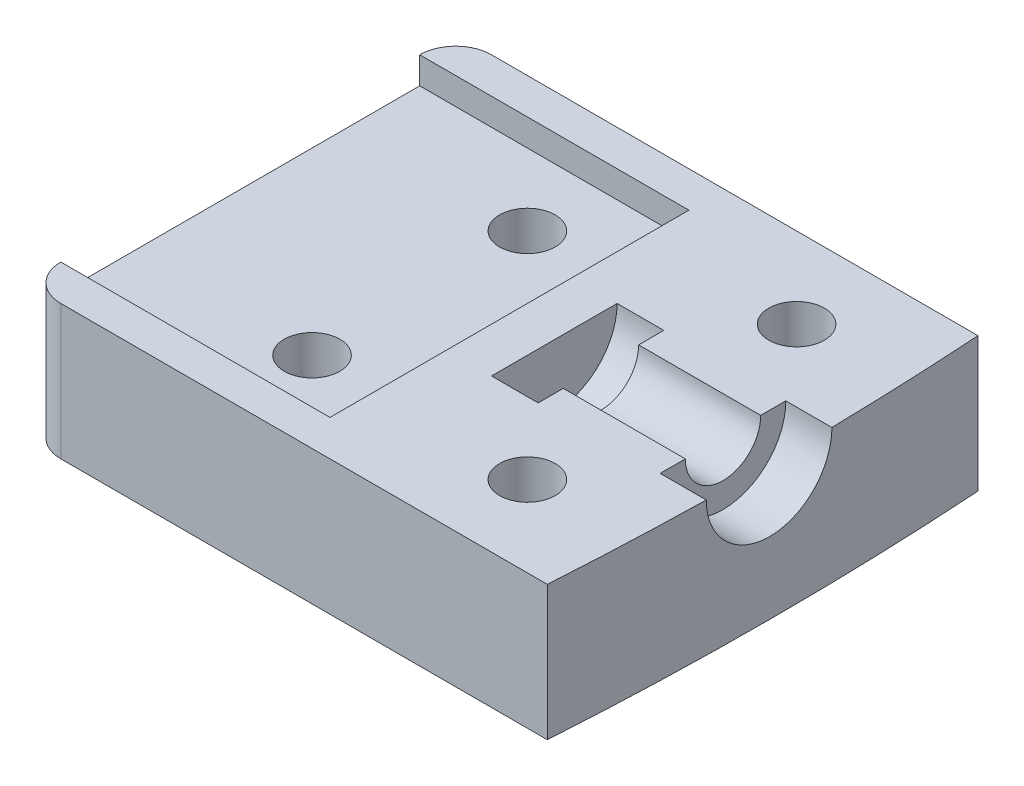
from build123d import *

# Parameters (mm, degrees)
BOSS_EXTRUDE1_DEPTH        = 10
SKETCH2_W                  = 15
SKETCH2_H                  = 20
CUT_EXTRUDE1_DEPTH         = 1.5
SKETCH4_R                  = 2.1
CUT_EXTRUDE2_DEPTH         = 24.457408211
FILLET1_R                  = 2
SKETCH5_R                  = 3.5
CUT_EXTRUDE3_DEPTH         = 2.6
SKETCH8_W                  = 2.6
SKETCH8_H                  = 3.5
F_3_1_3_1_DIAMETER_HOLE1_D = 3.1
F_3_1_3_1_DIAMETER_HOLE2_D = 3.1
CUT_EXTRUDE6_START         = -2.5
CUT_EXTRUDE6_DEPTH         = 2.5


with BuildPart() as part:
    # Sketch1 → Boss-Extrude1 (new body)
    with BuildSketch(Plane(origin=(0, 0, 0), x_dir=(1, 0, 0), z_dir=(0, 1, 0))):
        with BuildLine():
            Line((-25, -12), (4.109342511, -12))
            ThreePointArc((4.109342511, -12), (4.5, 0), (4.109342511, 12))
            Line((4.109342511, 12), (-25, 12))
            Line((-25, 12), (-25, -12))
        make_face()
    extrude(amount=BOSS_EXTRUDE1_DEPTH)

    # Sketch2 → Cut-Extrude1 (cut)
    with BuildSketch(Plane(origin=(0, 10, 0), x_dir=(1, 0, 0), z_dir=(0, 1, 0))):
        with Locations((-17.5, 0)):
            Rectangle(SKETCH2_W, SKETCH2_H)
    extrude(amount=-CUT_EXTRUDE1_DEPTH, mode=Mode.SUBTRACT)

    # Sketch4 → Cut-Extrude2 (cut, through all)
    with BuildSketch(Plane(origin=(-7.5, 0, 0), x_dir=(0, 0, -1), z_dir=(1, 0, 0))):
        with Locations((0, 10)):
            Circle(SKETCH4_R)
    extrude(amount=CUT_EXTRUDE2_DEPTH, mode=Mode.SUBTRACT)

    # Fillet1
    fillet1_edges = [part.edges().sort_by_distance(p)[0] for p in [
        (-25, 5, -12),
        (-25, 5, 12),
    ]]
    fillet(fillet1_edges, radius=FILLET1_R)

    # Sketch5 → Cut-Extrude3 (cut)
    with BuildSketch(Plane(origin=(-7.5, 0, 0), x_dir=(0, 0, -1), z_dir=(1, 0, 0))):
        with Locations((0, 10)):
            Circle(SKETCH5_R)
    extrude(amount=CUT_EXTRUDE3_DEPTH, mode=Mode.SUBTRACT)

    # Sketch8 → Cut-Revolve1 (revolve, cut)
    with BuildSketch(Plane(origin=(0, 10, 0), x_dir=(1, 0, 0), z_dir=(0, 1, 0))):
        with Locations((3.2, 1.75)):
            Rectangle(SKETCH8_W, SKETCH8_H)
    revolve(axis=Axis((0, 10, 0), (1, 0, 0)), mode=Mode.SUBTRACT)

    # Ø3.1 (3.1) Diameter Hole1 (through all)
    with Locations(Plane(origin=(0, 8.5, 0), x_dir=(1, 0, 0), z_dir=(0, 1, 0))):
        with Locations((-15, 6), (-15, -6)):
            Hole(F_3_1_3_1_DIAMETER_HOLE1_D / 2)

    # Ø3.1 (3.1) Diameter Hole2 (through all)
    with Locations(Plane(origin=(0, 10, 0), x_dir=(1, 0, 0), z_dir=(0, 1, 0))):
        with Locations((-1.5, 7.5), (-1.5, -7.5)):
            Hole(F_3_1_3_1_DIAMETER_HOLE2_D / 2)

    # Sketch17 → Cut-Extrude6 (cut)
    with BuildSketch(Plane.XZ.offset(CUT_EXTRUDE6_START)):
        with BuildLine():
            Line((-25, 10), (-25, -10))
            ThreePointArc((-25, -10), (-24.414213562, -11.414213562), (-23, -12))
            Line((-23, -12), (4.109342511, -12))
            ThreePointArc((4.109342511, -12), (4.5, 0), (4.109342511, 12))
            Line((4.109342511, 12), (-23, 12))
            ThreePointArc((-23, 12), (-24.414213562, 11.414213562), (-25, 10))
        make_face()
    extrude(amount=CUT_EXTRUDE6_DEPTH, mode=Mode.SUBTRACT)


solid = part.part
